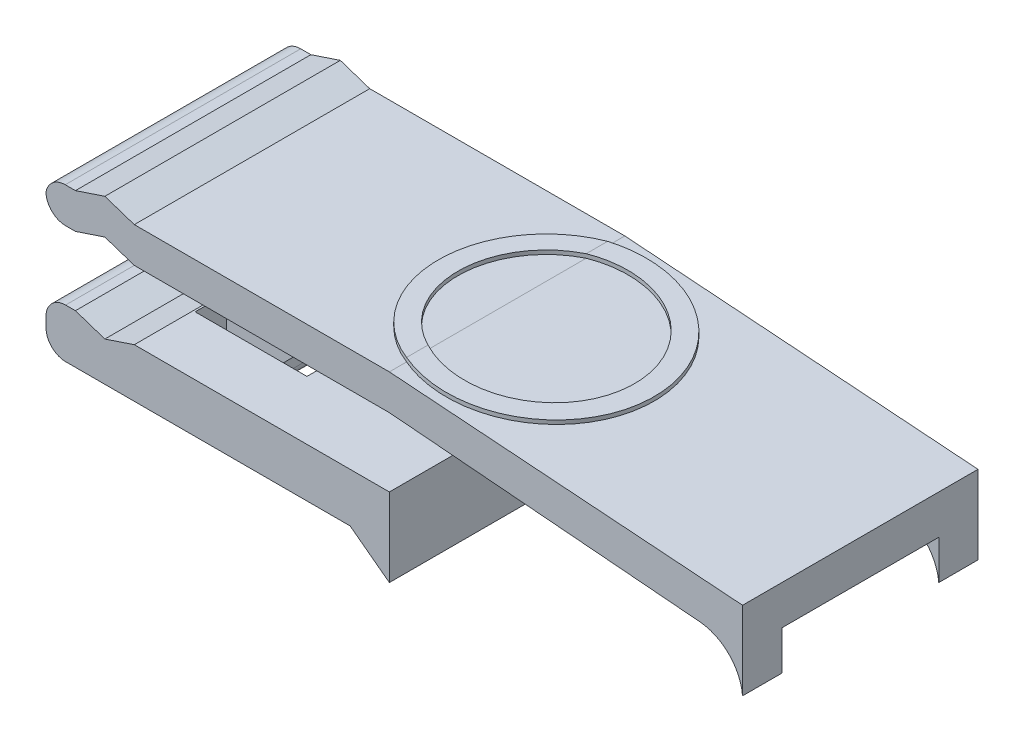
from build123d import *

# Parameters (mm, degrees)
BOSS_EXTRUDE1_DEPTH   = 12
BOSS_EXTRUDE1_2_DEPTH = 12
SKETCH2_W             = 5.7
SKETCH2_H             = 6
CUT_EXTRUDE1_DEPTH    = 3
BOSS_EXTRUDE2_DEPTH   = 6
BOSS_EXTRUDE3_START   = -6
BOSS_EXTRUDE3_DEPTH   = 2.5
FILLET7_R             = 1
FILLET8_R             = 1
FILLET10_R            = 1
FILLET11_R            = 1
BOSS_EXTRUDE4_DEPTH   = 2
BOSS_EXTRUDE5_START   = -10
BOSS_EXTRUDE5_DEPTH   = 2
FILLET12_R            = 0.5
BOSS_EXTRUDE7_REACH   = 45.42
BOSS_EXTRUDE7_START   = 5.5
SKETCH6_R             = 5.5
SKETCH6_R_2           = 4.5
CUT_EXTRUDE3_DEPTH    = 38.919520039


with BuildPart() as part:
    # Sketch1 → Boss-Extrude1 (new body)
    with BuildSketch(Plane.XY):
        Polygon((0, 4), (-18, 5.3), (-31, 5.3), (-32.5, 5.8), (-34, 5.3), (-35.5, 5.3), (-35.5, 3.5), (-34, 3.5), (-32.5, 4), (-31, 3.5), (-18, 3.5), (0, 2), align=None)
    extrude(amount=BOSS_EXTRUDE1_DEPTH)

    # Sketch4 → Boss-Extrude3 (add, symmetric)
    with BuildSketch(Plane.XY.offset(12).offset(BOSS_EXTRUDE3_START)):
        with BuildLine():
            Line((-28.4, -2), (-26.4, 0))
            Line((-26.4, 0), (-26.4, 0.4))
            Line((-26.4, 0.4), (-27.9, 0.4))
            Line((-27.9, 0.4), (-27.9, 1.9))
            ThreePointArc((-27.9, 1.9), (-27.43137085, 3.03137085), (-26.3, 3.5))
            Line((-26.3, 3.5), (-29.8, 3.5))
            Line((-29.8, 3.5), (-29.8, -3))
            Line((-29.8, -3), (-28.4, -3))
            Line((-28.4, -3), (-28.4, -2))
        make_face()
    extrude(amount=BOSS_EXTRUDE3_DEPTH, both=True)

    # Fillet8
    fillet8_edges = [part.edges().sort_by_distance(p)[0] for p in [
        (-35.5, 3.5, 6),
    ]]
    fillet(fillet8_edges, radius=FILLET8_R)

    # Fillet10
    # the kernel refuses this fillet: 1 mm, written as the material it takes off along each edge
    with BuildSketch(Plane(origin=(-35.5, 5.3, -2.449489743), x_dir=(1.545430450277731e-12, -1.0, 0), z_dir=(0, 0, 1))) as fillet10_piece_1:
        with BuildLine():
            CenterArc((1, 0.979795897), FILLET10_R, 180, 78.463040967)
            Line((0, 0.979795897), (-0.02, 0.979795897))
            Line((-0.02, 0.979795897), (-0.02, 0))
            Line((-0.02, 0), (0, -0.02))
            ThreePointArc((0, -0.02), (0.4, -0.02), (0.796, -0.019595918))
            Line((0.796, -0.019595918), (0.8, 0))
        make_face()
    extrude(amount=16.898979486, mode=Mode.SUBTRACT)

    # Sketch5 → Boss-Extrude4 (add)
    with BuildSketch(Plane.XY.offset(12)):
        with BuildLine():
            Line((0, 2), (0, 0))
            ThreePointArc((0, 0), (-0.691300526, 1.490517656), (-2.181818182, 2.181818182))
            Line((-2.181818182, 2.181818182), (0, 2))
        make_face()
    extrude(amount=-BOSS_EXTRUDE4_DEPTH)

    # Sketch5<2> → Boss-Extrude5 (add)
    with BuildSketch(Plane.XY.offset(12).offset(BOSS_EXTRUDE5_START)):
        with BuildLine():
            Line((0, 2), (0, 0))
            ThreePointArc((0, 0), (-0.691300526, 1.490517656), (-2.181818182, 2.181818182))
            Line((-2.181818182, 2.181818182), (0, 2))
        make_face()
    extrude(amount=-BOSS_EXTRUDE5_DEPTH)

    # Fillet12
    fillet12_edges = [part.edges().sort_by_distance(p)[0] for p in [
        (-28.4, -3, 6),
        (-29.8, -3, 6),
    ]]
    fillet(fillet12_edges, radius=FILLET12_R)

    # Sketch6 → Boss-Extrude7 (add, up to next)
    with BuildSketch(Plane(origin=(0, 0, 0), x_dir=(1, 0, 0), z_dir=(0, 1, 0)).offset(BOSS_EXTRUDE7_START), mode=Mode.PRIVATE) as boss_extrude7_sk1:
        with Locations(Location((-16, -6, 0), (0, 0, 270))):
            Circle(SKETCH6_R)
        with Locations(Location((-16, -6, 0), (0, 0, 270))):
            Circle(SKETCH6_R_2, mode=Mode.SUBTRACT)
    boss_extrude7_tool1 = extrude(boss_extrude7_sk1.sketch, amount=-BOSS_EXTRUDE7_REACH, mode=Mode.PRIVATE) - part.part
    add(boss_extrude7_tool1.solids().sort_by_distance((-16, 5.5, 0.655563))[0])

    # Sketch7 → Cut-Extrude3 (cut, through all)
    with BuildSketch(Plane.XY):
        Polygon((-18, 5.5), (-8, 4.777777778), (-8, 5.5), align=None)
    extrude(amount=CUT_EXTRUDE3_DEPTH, mode=Mode.SUBTRACT)


with BuildPart() as body_2:
    # Sketch1 → Boss-Extrude1 2 (new body)
    with BuildSketch(Plane.XY):
        Polygon((-35.5, -2.5), (-20, -2.5), (-18, -4), (-18, 0), (-31, 0), (-32.5, -0.5), (-34, 0), (-35.5, 0), align=None)
    extrude(amount=BOSS_EXTRUDE1_2_DEPTH)

    # Sketch2 → Cut-Extrude1 (cut)
    with BuildSketch(Plane.XZ.offset(2.5)):
        with Locations((-28.05, 6)):
            Rectangle(SKETCH2_W, SKETCH2_H)
    extrude(amount=-CUT_EXTRUDE1_DEPTH, mode=Mode.SUBTRACT)

    # Sketch3 → Boss-Extrude2 (add)
    with BuildSketch(Plane.XY.offset(3)):
        Polygon((-25.2, 0), (-27.2, -2), (-27.2, -2.5), (-25.2, -2.5), align=None)
    extrude(amount=BOSS_EXTRUDE2_DEPTH)

    # Fillet7
    fillet7_edges = [body_2.edges().sort_by_distance(p)[0] for p in [
        (-35.5, 0, 6),
    ]]
    fillet(fillet7_edges, radius=FILLET7_R)

    # Fillet11
    fillet11_edges = [body_2.edges().sort_by_distance(p)[0] for p in [
        (-35.5, -2.5, 6),
    ]]
    fillet(fillet11_edges, radius=FILLET11_R)


solid = Compound([part.part, body_2.part])
